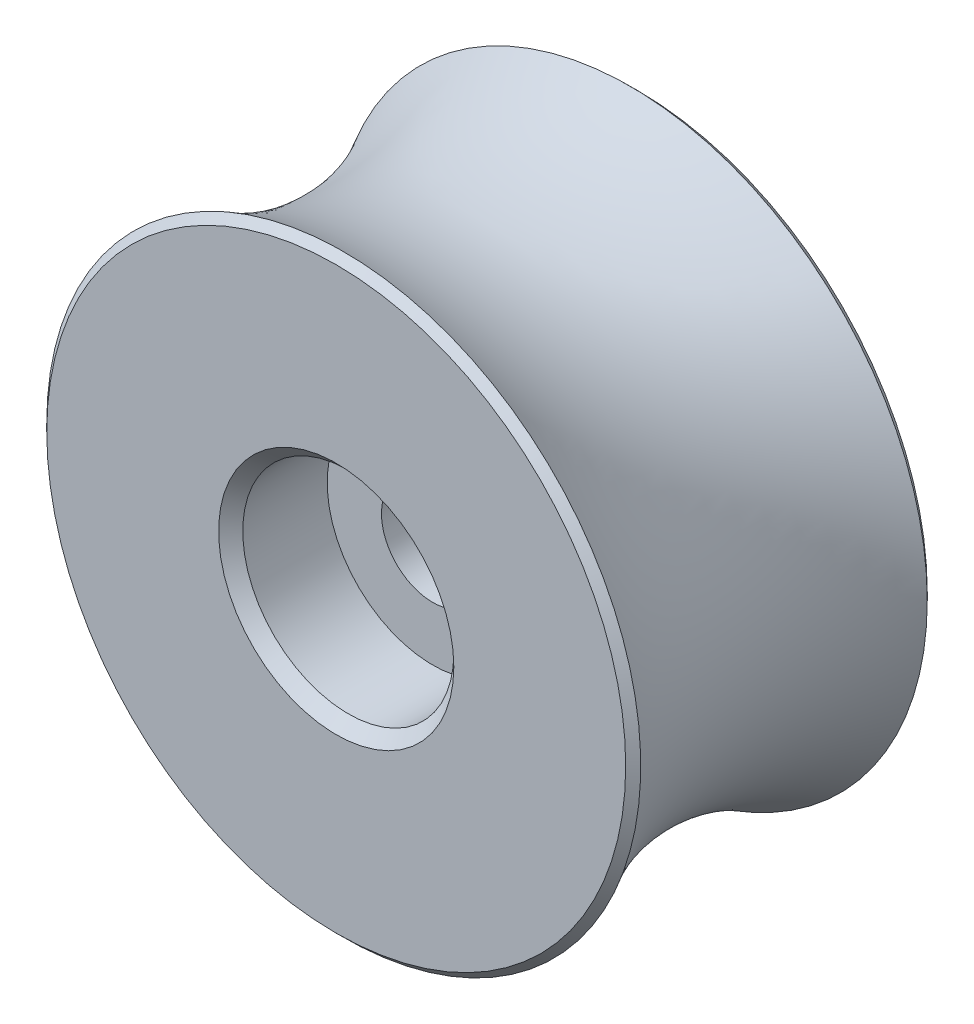
from build123d import *

# Parameters (mm, degrees)
SKETCH1_R           = 10
BOSS_EXTRUDE1_DEPTH = 10
CUT_EXTRUDE1_REACH  = 19.321
SKETCH2_R           = 1.7
SKETCH3_R           = 3.5
CUT_EXTRUDE2_DEPTH  = 3.2
CHAMFER1_SIZE       = 0.4
CHAMFER2_SIZE       = 0.4


with BuildPart() as part:
    # Sketch1 → Boss-Extrude1 (new body)
    with BuildSketch(Plane.XY):
        Circle(SKETCH1_R)
    extrude(amount=BOSS_EXTRUDE1_DEPTH)

    # Sketch2 → Cut-Extrude1 (cut, up to next)
    with BuildSketch(Plane.XY.offset(10), mode=Mode.PRIVATE) as cut_extrude1_sk1:
        Circle(SKETCH2_R)
    cut_extrude1_tool1 = extrude(cut_extrude1_sk1.sketch, amount=-CUT_EXTRUDE1_REACH, mode=Mode.PRIVATE) & part.part
    add(cut_extrude1_tool1.solids().sort_by_distance((0, 0, 10))[0], mode=Mode.SUBTRACT)

    # Sketch3 → Cut-Extrude2 (cut)
    with BuildSketch(Plane.XY.offset(10)):
        Circle(SKETCH3_R)
    cut_extrude2 = extrude(amount=-CUT_EXTRUDE2_DEPTH, mode=Mode.SUBTRACT)

    # Mirror1: Cut-Extrude2 across plane
    add(cut_extrude2.mirror(Plane.XY.offset(5)), mode=Mode.SUBTRACT)

    # Sketch4 → Cut-Revolve1 (revolve, cut)
    with BuildSketch(Plane(origin=(0, 0, 0), x_dir=(1, 0, 0), z_dir=(0, 1, 0)), mode=Mode.PRIVATE) as cut_revolve1_sk:
        with BuildLine():
            Line((10, -10), (10, 0))
            ThreePointArc((10, 0), (8.566018868, -5), (10, -10))
        make_face()
    revolve(cut_revolve1_sk.sketch.rotate(Axis((0, 0, 3.2), (0, 0, 1)), 180), axis=Axis((0, 0, 3.2), (0, 0, 1)), mode=Mode.SUBTRACT)

    # Chamfer1
    # the kernel refuses this chamfer: 0.4, 0.290276343 mm, written as the material it takes off along each edge
    with BuildSketch(Plane(origin=(0, 0, 10), x_dir=(1, 0, 0), z_dir=(0, -1, 0))) as chamfer1_piece_1:
        Polygon((3.5, -CHAMFER1_SIZE), (3.5 + CHAMFER1_SIZE, 0), (3.5, 0), align=None)
    revolve(axis=Axis((0, 0, 10), (0, 0, 1)), mode=Mode.SUBTRACT)
    with BuildSketch(Plane(origin=(0, 0, 0), x_dir=(1, 0, 0), z_dir=(0, -1, 0))) as chamfer1_piece_2:
        Polygon((3.5 + CHAMFER1_SIZE, 0), (3.5, CHAMFER1_SIZE), (3.5, 0), align=None)
    revolve(axis=Axis((0, 0, 0), (0, 0, 1)), mode=Mode.SUBTRACT)
    with BuildSketch(Plane(origin=(0, 0, 10), x_dir=(-1, 0, 0), z_dir=(0, -1, 0))) as chamfer1_piece_3:
        with BuildLine():
            Line((10 - CHAMFER1_SIZE, 0), (9.849418631, 0.249418631))
            ThreePointArc((9.849418631, 0.249418631), (9.922753807, 0.125772477), (10, 0))
            Line((10, 0), (10 - CHAMFER1_SIZE, 0))
        make_face()
    revolve(axis=Axis((0, 0, 10), (0, 0, -1)), mode=Mode.SUBTRACT)

    # Chamfer2
    # the kernel refuses this chamfer: 0.4, 0.290276343 mm, written as the material it takes off along each edge
    with BuildSketch(Plane(origin=(0, 0, 0), x_dir=(-1, 0, 0), z_dir=(0, -1, 0))) as chamfer2_piece_1:
        with BuildLine():
            Line((10 - CHAMFER2_SIZE, 0), (9.849418631, -0.249418631))
            ThreePointArc((9.849418631, -0.249418631), (9.922753807, -0.125772477), (10, 0))
            Line((10, 0), (10 - CHAMFER2_SIZE, 0))
        make_face()
    revolve(axis=Axis((0, 0, 0), (0, 0, -1)), mode=Mode.SUBTRACT)


solid = part.part
